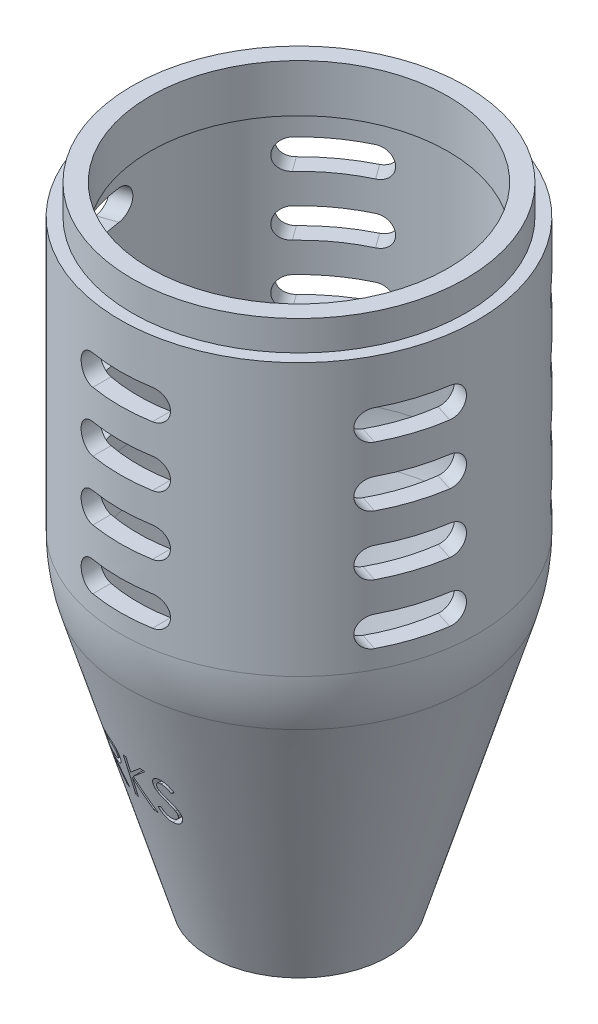
from build123d import *

# Parameters (mm, degrees)
SKETCH2_R                 = 28
SKETCH2_R_2               = 25
EXTRUDE_THIN1_DEPTH       = 5
CUT_EXTRUDE1_DEPTH        = 114.247516529
LPATTERN1_COUNT           = 4
LPATTERN1_PITCH           = 10
CIRPATTERN1_COUNT         = 5
CIRPATTERN1_COPY_1_DEPTH  = 114.247516529
CIRPATTERN1_COPY_2_DEPTH  = 114.247516529
CIRPATTERN1_COPY_3_DEPTH  = 114.247516529
CIRPATTERN1_COPY_4_DEPTH  = 114.247516529
CIRPATTERN1_COPY_5_DEPTH  = 114.247516529
CIRPATTERN1_COPY_6_DEPTH  = 114.247516529
CIRPATTERN1_COPY_7_DEPTH  = 114.247516529
CIRPATTERN1_COPY_8_DEPTH  = 114.247516529
CIRPATTERN1_COPY_9_DEPTH  = 114.247516529
CIRPATTERN1_COPY_10_DEPTH = 114.247516529
CIRPATTERN1_COPY_11_DEPTH = 114.247516529
CIRPATTERN1_COPY_12_DEPTH = 114.247516529
CUT_EXTRUDE2_DEPTH        = 114.247516582


# Read off the part's stored shape, not the designer's step: Shell1
with BuildPart() as part:
    # Sketch1 → Revolve1 (revolve)
    with BuildSketch(Plane.XY, mode=Mode.PRIVATE) as revolve1_sk:
        with BuildLine():
            Line((0, 0), (15, 0))
            Line((15, 0), (28.734788557, 45.782628522))
            ThreePointArc((28.734788557, 45.782628522), (29.682011865, 50.046670749), (30, 54.403065089))
            Line((30, 54.403065089), (30, 100))
            Line((30, 100), (0, 100))
            Line((0, 100), (0, 0))
        make_face()
    revolve(revolve1_sk.sketch.rotate(Axis((0, 100, 0), (0, -1, 0)), 180), axis=Axis((0, 100, 0), (0, -1, 0)))

    # Sketch2 → Extrude-Thin1 (add)
    with BuildSketch(Plane(origin=(0, 100, 0), x_dir=(1, 0, 0), z_dir=(0, 1, 0))):
        Circle(SKETCH2_R)
        Circle(SKETCH2_R_2, mode=Mode.SUBTRACT)
    extrude(amount=EXTRUDE_THIN1_DEPTH)

    # Shell1 outline → Shell1 (revolve, cut)
    with BuildSketch(Plane.XY):
        with BuildLine():
            Line((25, 97), (25, 100))
            Line((25, 100), (0, 100))
            Line((0, 100), (0, 0))
            Line((0, 0), (11.867908047, 0))
            Line((11.867908047, 0), (25.861309693, 46.644672153))
            ThreePointArc((25.861309693, 46.644672153), (26.713810678, 50.482310183), (27, 54.403065116))
            Line((27, 54.403065116), (27, 97))
            Line((27, 97), (25, 97))
        make_face()
    revolve(axis=Axis((0, 0, 0), (0, 1, 0)), mode=Mode.SUBTRACT)

    # Sketch3 → Cut-Extrude1 (cut, through all)
    with BuildSketch(Plane.XY):
        with BuildLine():
            Line((-5, 62.5), (5, 62.5))
            ThreePointArc((5, 62.5), (7.5, 60), (5, 57.5))
            Line((5, 57.5), (-5, 57.5))
            ThreePointArc((-5, 57.5), (-7.5, 60), (-5, 62.5))
        make_face()
    cut_extrude1 = extrude(amount=CUT_EXTRUDE1_DEPTH, mode=Mode.SUBTRACT)

    # LPattern1: Cut-Extrude1 ×4
    with Locations(*[(0, i * LPATTERN1_PITCH, 0) for i in range(1, LPATTERN1_COUNT)]):
        add(cut_extrude1, mode=Mode.SUBTRACT)

    # CirPattern1: Cut-Extrude1 ×5 about axis
    cirpattern1_axis = Axis((0, 100, 0), (0, 1, 0))
    for i in range(1, CIRPATTERN1_COUNT):
        add(cut_extrude1.rotate(cirpattern1_axis, i * 360 / CIRPATTERN1_COUNT), mode=Mode.SUBTRACT)

    # CirPattern1 copy 1 sketch → CirPattern1 copy 1 (cut, through all)
    with BuildSketch(Plane(origin=(0, 10, 0), x_dir=(0.30901699437494745, 0, -0.9510565162951535), z_dir=(0.9510565162951535, 0, 0.30901699437494745))):
        with BuildLine():
            Line((-5, 62.5), (5, 62.5))
            ThreePointArc((5, 62.5), (7.5, 60), (5, 57.5))
            Line((5, 57.5), (-5, 57.5))
            ThreePointArc((-5, 57.5), (-7.5, 60), (-5, 62.5))
        make_face()
    extrude(amount=CIRPATTERN1_COPY_1_DEPTH, mode=Mode.SUBTRACT)

    # CirPattern1 copy 2 sketch → CirPattern1 copy 2 (cut, through all)
    with BuildSketch(Plane(origin=(0, 10, 0), x_dir=(-0.8090169943749473, 0, -0.5877852522924732), z_dir=(0.5877852522924732, 0, -0.8090169943749473))):
        with BuildLine():
            Line((-5, 62.5), (5, 62.5))
            ThreePointArc((5, 62.5), (7.5, 60), (5, 57.5))
            Line((5, 57.5), (-5, 57.5))
            ThreePointArc((-5, 57.5), (-7.5, 60), (-5, 62.5))
        make_face()
    extrude(amount=CIRPATTERN1_COPY_2_DEPTH, mode=Mode.SUBTRACT)

    # CirPattern1 copy 3 sketch → CirPattern1 copy 3 (cut, through all)
    with BuildSketch(Plane(origin=(0, 10, 0), x_dir=(-0.8090169943749476, 0, 0.587785252292473), z_dir=(-0.587785252292473, 0, -0.8090169943749476))):
        with BuildLine():
            Line((-5, 62.5), (5, 62.5))
            ThreePointArc((5, 62.5), (7.5, 60), (5, 57.5))
            Line((5, 57.5), (-5, 57.5))
            ThreePointArc((-5, 57.5), (-7.5, 60), (-5, 62.5))
        make_face()
    extrude(amount=CIRPATTERN1_COPY_3_DEPTH, mode=Mode.SUBTRACT)

    # CirPattern1 copy 4 sketch → CirPattern1 copy 4 (cut, through all)
    with BuildSketch(Plane(origin=(0, 10, 0), x_dir=(0.30901699437494723, 0, 0.9510565162951536), z_dir=(-0.9510565162951536, 0, 0.30901699437494723))):
        with BuildLine():
            Line((-5, 62.5), (5, 62.5))
            ThreePointArc((5, 62.5), (7.5, 60), (5, 57.5))
            Line((5, 57.5), (-5, 57.5))
            ThreePointArc((-5, 57.5), (-7.5, 60), (-5, 62.5))
        make_face()
    extrude(amount=CIRPATTERN1_COPY_4_DEPTH, mode=Mode.SUBTRACT)

    # CirPattern1 copy 5 sketch → CirPattern1 copy 5 (cut, through all)
    with BuildSketch(Plane(origin=(0, 20, 0), x_dir=(0.30901699437494745, 0, -0.9510565162951535), z_dir=(0.9510565162951535, 0, 0.30901699437494745))):
        with BuildLine():
            Line((-5, 62.5), (5, 62.5))
            ThreePointArc((5, 62.5), (7.5, 60), (5, 57.5))
            Line((5, 57.5), (-5, 57.5))
            ThreePointArc((-5, 57.5), (-7.5, 60), (-5, 62.5))
        make_face()
    extrude(amount=CIRPATTERN1_COPY_5_DEPTH, mode=Mode.SUBTRACT)

    # CirPattern1 copy 6 sketch → CirPattern1 copy 6 (cut, through all)
    with BuildSketch(Plane(origin=(0, 20, 0), x_dir=(-0.8090169943749473, 0, -0.5877852522924732), z_dir=(0.5877852522924732, 0, -0.8090169943749473))):
        with BuildLine():
            Line((-5, 62.5), (5, 62.5))
            ThreePointArc((5, 62.5), (7.5, 60), (5, 57.5))
            Line((5, 57.5), (-5, 57.5))
            ThreePointArc((-5, 57.5), (-7.5, 60), (-5, 62.5))
        make_face()
    extrude(amount=CIRPATTERN1_COPY_6_DEPTH, mode=Mode.SUBTRACT)

    # CirPattern1 copy 7 sketch → CirPattern1 copy 7 (cut, through all)
    with BuildSketch(Plane(origin=(0, 20, 0), x_dir=(-0.8090169943749476, 0, 0.587785252292473), z_dir=(-0.587785252292473, 0, -0.8090169943749476))):
        with BuildLine():
            Line((-5, 62.5), (5, 62.5))
            ThreePointArc((5, 62.5), (7.5, 60), (5, 57.5))
            Line((5, 57.5), (-5, 57.5))
            ThreePointArc((-5, 57.5), (-7.5, 60), (-5, 62.5))
        make_face()
    extrude(amount=CIRPATTERN1_COPY_7_DEPTH, mode=Mode.SUBTRACT)

    # CirPattern1 copy 8 sketch → CirPattern1 copy 8 (cut, through all)
    with BuildSketch(Plane(origin=(0, 20, 0), x_dir=(0.30901699437494723, 0, 0.9510565162951536), z_dir=(-0.9510565162951536, 0, 0.30901699437494723))):
        with BuildLine():
            Line((-5, 62.5), (5, 62.5))
            ThreePointArc((5, 62.5), (7.5, 60), (5, 57.5))
            Line((5, 57.5), (-5, 57.5))
            ThreePointArc((-5, 57.5), (-7.5, 60), (-5, 62.5))
        make_face()
    extrude(amount=CIRPATTERN1_COPY_8_DEPTH, mode=Mode.SUBTRACT)

    # CirPattern1 copy 9 sketch → CirPattern1 copy 9 (cut, through all)
    with BuildSketch(Plane(origin=(0, 30, 0), x_dir=(0.30901699437494745, 0, -0.9510565162951535), z_dir=(0.9510565162951535, 0, 0.30901699437494745))):
        with BuildLine():
            Line((-5, 62.5), (5, 62.5))
            ThreePointArc((5, 62.5), (7.5, 60), (5, 57.5))
            Line((5, 57.5), (-5, 57.5))
            ThreePointArc((-5, 57.5), (-7.5, 60), (-5, 62.5))
        make_face()
    extrude(amount=CIRPATTERN1_COPY_9_DEPTH, mode=Mode.SUBTRACT)

    # CirPattern1 copy 10 sketch → CirPattern1 copy 10 (cut, through all)
    with BuildSketch(Plane(origin=(0, 30, 0), x_dir=(-0.8090169943749473, 0, -0.5877852522924732), z_dir=(0.5877852522924732, 0, -0.8090169943749473))):
        with BuildLine():
            Line((-5, 62.5), (5, 62.5))
            ThreePointArc((5, 62.5), (7.5, 60), (5, 57.5))
            Line((5, 57.5), (-5, 57.5))
            ThreePointArc((-5, 57.5), (-7.5, 60), (-5, 62.5))
        make_face()
    extrude(amount=CIRPATTERN1_COPY_10_DEPTH, mode=Mode.SUBTRACT)

    # CirPattern1 copy 11 sketch → CirPattern1 copy 11 (cut, through all)
    with BuildSketch(Plane(origin=(0, 30, 0), x_dir=(-0.8090169943749476, 0, 0.587785252292473), z_dir=(-0.587785252292473, 0, -0.8090169943749476))):
        with BuildLine():
            Line((-5, 62.5), (5, 62.5))
            ThreePointArc((5, 62.5), (7.5, 60), (5, 57.5))
            Line((5, 57.5), (-5, 57.5))
            ThreePointArc((-5, 57.5), (-7.5, 60), (-5, 62.5))
        make_face()
    extrude(amount=CIRPATTERN1_COPY_11_DEPTH, mode=Mode.SUBTRACT)

    # CirPattern1 copy 12 sketch → CirPattern1 copy 12 (cut, through all)
    with BuildSketch(Plane(origin=(0, 30, 0), x_dir=(0.30901699437494723, 0, 0.9510565162951536), z_dir=(-0.9510565162951536, 0, 0.30901699437494723))):
        with BuildLine():
            Line((-5, 62.5), (5, 62.5))
            ThreePointArc((5, 62.5), (7.5, 60), (5, 57.5))
            Line((5, 57.5), (-5, 57.5))
            ThreePointArc((-5, 57.5), (-7.5, 60), (-5, 62.5))
        make_face()
    extrude(amount=CIRPATTERN1_COPY_12_DEPTH, mode=Mode.SUBTRACT)

    # Sketch5 → Cut-Extrude2 (cut, through all)
    # profile 1 of 3: a face of its own
    with BuildSketch(Plane.XY):
        with BuildLine():
            Line((-11.973032472, 30.521055221), (-10.596372316, 30.521055221))
            add(Edge.make_bspline(
                [(-10.596372316, 30.521055221), (-10.504503741, 30.52074942), (-10.3281059, 30.520162249), (-10.075398198, 30.516888232), (-9.845777321, 30.507504349), (-9.639363327, 30.499429026), (-9.456160004, 30.484703794), (-9.295605579, 30.470629713), (-9.158439521, 30.452206005), (-9.075406306, 30.435095704), (-9.037811118, 30.427348623)],
                knots=[0, 0, 0, 0, 1.410062039, 2.707475311, 3.878576406, 4.937260626, 5.877586885, 6.699081471, 7.410979367, 8, 8, 8, 8], degree=3))
            add(Edge.make_bspline(
                [(-9.037811118, 30.427348623), (-8.987481908, 30.414913517), (-8.887897147, 30.390308578), (-8.744515529, 30.338302862), (-8.60788678, 30.278120719), (-8.478578447, 30.207434883), (-8.357238219, 30.125720644), (-8.242614968, 30.034388655), (-8.134188563, 29.933938659), (-8.036343954, 29.821838036), (-7.944086366, 29.704230801), (-7.866275863, 29.577057108), (-7.79920108, 29.444069986), (-7.745798075, 29.303916955), (-7.702797439, 29.15795721), (-7.672477533, 29.004868635), (-7.654294544, 28.84534867), (-7.65244335, 28.736544019), (-7.651504695, 28.681374231)],
                knots=[0, 0, 0, 0, 1.027469482, 2.033020251, 3.019912614, 3.986113645, 4.951240523, 5.91722682, 6.890402269, 7.87763091, 8.8651537, 9.85103654, 10.82876324, 11.815024772, 12.821070561, 13.842952187, 14.906261191, 16, 16, 16, 16], degree=3))
            add(Edge.make_bspline(
                [(-7.651504695, 28.681374231), (-7.654391976, 28.589714043), (-7.660025808, 28.410861276), (-7.712553363, 28.151298758), (-7.79859507, 27.909173093), (-7.917159059, 27.684789147), (-8.068145909, 27.482520723), (-8.249608088, 27.304860436), (-8.461646827, 27.156191988), (-8.659038256, 27.05309725), (-8.833403903, 26.987071188), (-8.976949141, 26.940614487), (-9.133532688, 26.904721029), (-9.301654283, 26.87256558), (-9.482013563, 26.848288618), (-9.674178247, 26.830507752), (-9.878285386, 26.819394854), (-10.018500628, 26.817739914), (-10.090632299, 26.816888554)],
                knots=[0, 0, 0, 0, 1.260483769, 2.459530307, 3.627416485, 4.787058657, 5.939039949, 7.08810263, 8.267026773, 9.491475466, 10.141966685, 10.831826277, 11.566392101, 12.351337768, 13.187381173, 14.07005841, 15.007169909, 16, 16, 16, 16], degree=3))
            Line((-10.090632299, 26.816888554), (-7.56331025, 23.641888554))
            Line((-7.56331025, 23.641888554), (-8.32674341, 23.641888554))
            Line((-8.32674341, 23.641888554), (-10.854065459, 26.816888554))
            Line((-10.854065459, 26.816888554), (-11.355671361, 26.816888554))
            Line((-11.355671361, 26.816888554), (-11.355671361, 23.641888554))
            Line((-11.355671361, 23.641888554), (-11.973032472, 23.641888554))
            Line((-11.973032472, 23.641888554), (-11.973032472, 30.521055221))
        make_face()
        with BuildLine():
            Line((-11.355671361, 29.815499665), (-11.355671361, 27.522444109))
            Line((-11.355671361, 27.522444109), (-10.096144452, 27.512797842))
            add(Edge.make_bspline(
                [(-10.096144452, 27.512797842), (-10.037337328, 27.512771826), (-9.923352372, 27.512721399), (-9.758447613, 27.520571071), (-9.604904393, 27.529500855), (-9.46331001, 27.543159628), (-9.333601209, 27.560762574), (-9.215842822, 27.582781772), (-9.109842623, 27.608435291), (-8.986217044, 27.648141105), (-8.848168814, 27.711048172), (-8.698141147, 27.802571551), (-8.5703806, 27.91768776), (-8.462440849, 28.049322494), (-8.375705502, 28.194052787), (-8.3145555, 28.35014377), (-8.2757522, 28.513654875), (-8.271175499, 28.626037085), (-8.268865806, 28.682752269)],
                knots=[0, 0, 0, 0, 1.146690395, 2.22261258, 3.21895312, 4.145990853, 4.996080663, 5.770904154, 6.481378293, 7.121626537, 8.300444488, 9.431385265, 10.535395872, 11.636531494, 12.74115979, 13.810798291, 14.895190096, 16, 16, 16, 16], degree=3))
            add(Edge.make_bspline(
                [(-8.268865806, 28.682752269), (-8.271228546, 28.73807369), (-8.275910635, 28.847700559), (-8.314136727, 29.008193306), (-8.378780023, 29.159666562), (-8.465894326, 29.301504139), (-8.57202838, 29.430254103), (-8.696478033, 29.540413448), (-8.835840506, 29.63131567), (-8.966094968, 29.689404101), (-9.082518403, 29.725018241), (-9.183602175, 29.75008035), (-9.297818901, 29.77021561), (-9.425723165, 29.786348358), (-9.566768942, 29.800214683), (-9.7216694, 29.809554191), (-9.88939681, 29.815084773), (-10.005648695, 29.815358149), (-10.065827611, 29.815499665)],
                knots=[0, 0, 0, 0, 1.101028733, 2.181837193, 3.264309656, 4.369019818, 5.486613113, 6.575447106, 7.666700264, 8.788928104, 9.402425223, 10.0903467, 10.862060571, 11.710948788, 12.657782767, 13.684531032, 14.801375019, 16, 16, 16, 16], degree=3))
            Line((-10.065827611, 29.815499665), (-11.355671361, 29.815499665))
        make_face(mode=Mode.SUBTRACT)
    # profile 2 of 3: a face of its own
    with BuildSketch(Plane.XY):
        Polygon((-6.152199139, 30.521055221), (-5.534838028, 30.521055221), (-5.534838028, 27.901404613), (-2.667140545, 30.521055221), (-1.786574139, 30.521055221), (-5.16690183, 27.434249665), (-1.521990806, 23.641888554), (-2.344679608, 23.641888554), (-5.534838028, 26.961582564), (-5.534838028, 23.641888554), (-6.152199139, 23.641888554), align=None)
    # profile 3 of 3: a face of its own
    with BuildSketch(Plane.XY):
        with BuildLine():
            Line((-1.21331025, 24.968939335), (-0.631778132, 25.317582998))
            add(Edge.make_bspline(
                [(-0.631778132, 25.317582998), (-0.577691692, 25.227044546), (-0.47406416, 25.053576367), (-0.301197858, 24.819177528), (-0.122078291, 24.619952622), (0.064620983, 24.457060623), (0.257760364, 24.32881549), (0.458600689, 24.238006103), (0.666465148, 24.18136899), (0.80792798, 24.174489653), (0.878551729, 24.171055221)],
                knots=[0, 0, 0, 0, 1.272034388, 2.437168799, 3.508375237, 4.49857839, 5.41946034, 6.295179144, 7.148887113, 8, 8, 8, 8], degree=3))
            add(Edge.make_bspline(
                [(0.878551729, 24.171055221), (0.938866023, 24.172735059), (1.058439252, 24.176065343), (1.234471708, 24.208064872), (1.405432369, 24.257225615), (1.56779768, 24.327630803), (1.719327274, 24.412811565), (1.852206624, 24.515696731), (1.967081068, 24.630885833), (2.061048745, 24.759393884), (2.133142481, 24.897600565), (2.18855332, 25.039460679), (2.21930334, 25.18720271), (2.223935482, 25.28667637), (2.226273083, 25.336875533)],
                knots=[0, 0, 0, 0, 1.095163259, 2.171163733, 3.241058638, 4.321873601, 5.38011039, 6.391990106, 7.366004449, 8.327778327, 9.272591725, 10.192022065, 11.087607919, 12, 12, 12, 12], degree=3))
            add(Edge.make_bspline(
                [(2.226273083, 25.336875533), (2.223375361, 25.394151179), (2.217484714, 25.510584199), (2.167696293, 25.682366136), (2.089373547, 25.852365223), (2.017117446, 25.957520686), (1.979604246, 26.012114248)],
                knots=[0, 0, 0, 0, 0.938893495, 1.908633276, 2.914225137, 4, 4, 4, 4], degree=3))
            add(Edge.make_bspline(
                [(1.979604246, 26.012114248), (1.948804027, 26.051515803), (1.88414282, 26.134234438), (1.772980376, 26.257362157), (1.642539358, 26.384368121), (1.49728368, 26.520102053), (1.331922098, 26.658251044), (1.151633852, 26.805402861), (0.951815958, 26.955961437), (0.811678495, 27.056932992), (0.739369871, 27.109032651)],
                knots=[0, 0, 0, 0, 0.722233717, 1.516239348, 2.393582979, 3.351407094, 4.387010283, 5.505090956, 6.712668013, 8, 8, 8, 8], degree=3))
            add(Edge.make_bspline(
                [(0.739369871, 27.109032651), (0.666993184, 27.160584316), (0.528614468, 27.259147172), (0.335096469, 27.405426331), (0.162047173, 27.539164936), (0.010235725, 27.661621988), (-0.120271102, 27.772814096), (-0.230501711, 27.871673498), (-0.317648089, 27.960873806), (-0.366108046, 28.018740062), (-0.387865372, 28.044720585)],
                knots=[0, 0, 0, 0, 1.452282411, 2.77665338, 3.964542531, 5.026858415, 5.96415736, 6.766646006, 7.446254459, 8, 8, 8, 8], degree=3))
            add(Edge.make_bspline(
                [(-0.387865372, 28.044720585), (-0.418276291, 28.085211433), (-0.478083445, 28.164842118), (-0.557028773, 28.289305618), (-0.624128484, 28.416714203), (-0.676729211, 28.547410242), (-0.721023612, 28.679558894), (-0.750816164, 28.814884378), (-0.769471279, 28.952779472), (-0.771381695, 29.045576483), (-0.772338028, 29.092029613)],
                knots=[0, 0, 0, 0, 1.068054152, 2.10047183, 3.106115577, 4.101338837, 5.06977816, 6.043150881, 7.020423561, 8, 8, 8, 8], degree=3))
            add(Edge.make_bspline(
                [(-0.772338028, 29.092029613), (-0.769772671, 29.164810753), (-0.764696789, 29.308817388), (-0.721769772, 29.519183937), (-0.654014121, 29.720028907), (-0.559091669, 29.909363884), (-0.436726324, 30.082258925), (-0.295121676, 30.240702814), (-0.126461243, 30.373900349), (0.058593496, 30.49028024), (0.261148342, 30.581372053), (0.473401891, 30.650087027), (0.695691493, 30.689021651), (0.84625313, 30.694609038), (0.922648951, 30.697444109)],
                knots=[0, 0, 0, 0, 1.005424448, 1.989358655, 2.955360095, 3.929531133, 4.905563448, 5.876582895, 6.856512386, 7.866279853, 8.892233794, 9.918561126, 10.94386622, 12, 12, 12, 12], degree=3))
            add(Edge.make_bspline(
                [(0.922648951, 30.697444109), (1.003713248, 30.694648118), (1.164924262, 30.689087784), (1.402057423, 30.640741922), (1.630368545, 30.56074572), (1.814029057, 30.469963013), (1.957769759, 30.379292814), (2.067389737, 30.296703849), (2.178473441, 30.201623725), (2.291916903, 30.093799183), (2.40579789, 29.972240867), (2.52180708, 29.837781286), (2.640215756, 29.691242151), (2.716389476, 29.586630662), (2.75543975, 29.533001835)],
                knots=[0, 0, 0, 0, 1.286793592, 2.559021753, 3.825965368, 5.121522368, 5.803751409, 6.523245864, 7.299691795, 8.125521123, 9.008227632, 9.944561021, 10.946284179, 12, 12, 12, 12], degree=3))
            Line((2.75543975, 29.533001835), (2.197334281, 29.109944109))
            add(Edge.make_bspline(
                [(2.197334281, 29.109944109), (2.163634359, 29.153358905), (2.098736188, 29.236965649), (2.000207876, 29.354051652), (1.907341783, 29.461005946), (1.815848081, 29.55390443), (1.730558931, 29.637834457), (1.647778887, 29.709691788), (1.568699228, 29.770180488), (1.469016348, 29.834733723), (1.343780689, 29.898722756), (1.186572988, 29.952869813), (1.022286154, 29.985408393), (0.910392319, 29.989710599), (0.853747041, 29.991888554)],
                knots=[0, 0, 0, 0, 1.181633172, 2.275549214, 3.290209073, 4.226197932, 5.078386478, 5.862611352, 6.581680152, 7.217281963, 8.414376989, 9.595101626, 10.782541182, 12, 12, 12, 12], degree=3))
            add(Edge.make_bspline(
                [(0.853747041, 29.991888554), (0.782682257, 29.989506986), (0.645640516, 29.984914358), (0.451077564, 29.934755435), (0.275965576, 29.855778945), (0.125503332, 29.745093196), (0.000229821, 29.613954674), (-0.090389361, 29.463047662), (-0.144931648, 29.296409868), (-0.1515873, 29.180168351), (-0.154976917, 29.120968415)],
                knots=[0, 0, 0, 0, 1.14458467, 2.207223713, 3.21896685, 4.227309161, 5.202851033, 6.127160689, 7.046193047, 8, 8, 8, 8], degree=3))
            add(Edge.make_bspline(
                [(-0.154976917, 29.120968415), (-0.154204236, 29.08411283), (-0.15265761, 29.010341395), (-0.131086907, 28.901352945), (-0.103375011, 28.792639825), (-0.059461101, 28.684690796), (0.001164609, 28.575617954), (0.080776568, 28.463543087), (0.181042018, 28.34747836), (0.257846956, 28.271989581), (0.298397649, 28.23213378)],
                knots=[0, 0, 0, 0, 0.858281714, 1.717966888, 2.583508476, 3.4729293, 4.427298488, 5.488583878, 6.674047936, 8, 8, 8, 8], degree=3))
            add(Edge.make_bspline(
                [(0.298397649, 28.23213378), (0.313455894, 28.218695768), (0.349230837, 28.186770129), (0.414633877, 28.134503634), (0.501002401, 28.070030566), (0.606081084, 27.990257162), (0.731807411, 27.89771967), (0.878195205, 27.793601296), (1.043612694, 27.674522019), (1.160994698, 27.591269281), (1.223061278, 27.547248797)],
                knots=[0, 0, 0, 0, 0.420754252, 0.999615792, 1.744751191, 2.668019286, 3.750313428, 4.999500688, 6.413464383, 8, 8, 8, 8], degree=3))
            add(Edge.make_bspline(
                [(1.223061278, 27.547248797), (1.297721686, 27.492920363), (1.442291218, 27.38772088), (1.6479932, 27.229665776), (1.83450472, 27.075085459), (2.002480612, 26.924967091), (2.153580345, 26.780449375), (2.28612758, 26.639793648), (2.401472887, 26.504007599), (2.525650137, 26.329920311), (2.652536994, 26.11611368), (2.761505957, 25.854158475), (2.830215756, 25.591184993), (2.839200961, 25.414435937), (2.843634194, 25.327229266)],
                knots=[0, 0, 0, 0, 1.163667725, 2.253281268, 3.268753668, 4.215851969, 5.092017293, 5.902905408, 6.650798638, 7.335211899, 8.59617414, 9.77448103, 10.901945474, 12, 12, 12, 12], degree=3))
            add(Edge.make_bspline(
                [(2.843634194, 25.327229266), (2.842342605, 25.265555836), (2.839784508, 25.143406634), (2.810379188, 24.964046953), (2.767296608, 24.789845089), (2.702362711, 24.622954319), (2.623108504, 24.460321458), (2.522542462, 24.306212596), (2.40597462, 24.157216925), (2.272255875, 24.017307467), (2.125934226, 23.888871075), (1.971283298, 23.774619789), (1.808049964, 23.679356453), (1.637119739, 23.601620215), (1.45845336, 23.540821123), (1.272110919, 23.496769162), (1.077785248, 23.46973264), (0.945704302, 23.466926409), (0.878551729, 23.465499665)],
                knots=[0, 0, 0, 0, 0.983748083, 1.948392443, 2.894712957, 3.844097841, 4.80183111, 5.778335162, 6.776009319, 7.81870978, 8.863265674, 9.881300176, 10.883814829, 11.87499822, 12.874611388, 13.892143829, 14.928324115, 16, 16, 16, 16], degree=3))
            add(Edge.make_bspline(
                [(0.878551729, 23.465499665), (0.826593692, 23.46650438), (0.723331975, 23.468501157), (0.570595839, 23.48615365), (0.420945289, 23.51112916), (0.27625817, 23.550780814), (0.134670353, 23.59888973), (-0.003202366, 23.658125905), (-0.137426807, 23.729113404), (-0.268755175, 23.810277792), (-0.396853463, 23.904734145), (-0.520520179, 24.014748719), (-0.6438129, 24.137287325), (-0.763092532, 24.275677611), (-0.880771772, 24.427683771), (-0.994530408, 24.594727988), (-1.106723165, 24.775900382), (-1.177117614, 24.903391163), (-1.21331025, 24.968939335)],
                knots=[0, 0, 0, 0, 0.915332311, 1.819136955, 2.706846663, 3.586547465, 4.459518054, 5.340707479, 6.227863349, 7.133153174, 8.059268498, 9.028702269, 10.047606654, 11.120612155, 12.245963614, 13.433783089, 14.680604001, 16, 16, 16, 16], degree=3))
        make_face()
    extrude(amount=CUT_EXTRUDE2_DEPTH, mode=Mode.SUBTRACT)


with BuildPart() as cut_extrude2_piece_1:
    # of the separate pieces the step leaves, piece 1, a body of its own (cut_extrude2_pieces)
    add(part.part.solids().sort_by_distance((-15, 0, 0))[0])


with BuildPart() as cut_extrude2_piece_2:
    # of the separate pieces the step leaves, piece 2, a body of its own (cut_extrude2_pieces)
    add(part.part.solids().sort_by_distance((-11.355671361, 27.522444109, 20.295919999))[0])


solid = Compound([cut_extrude2_piece_1.part, cut_extrude2_piece_2.part])
